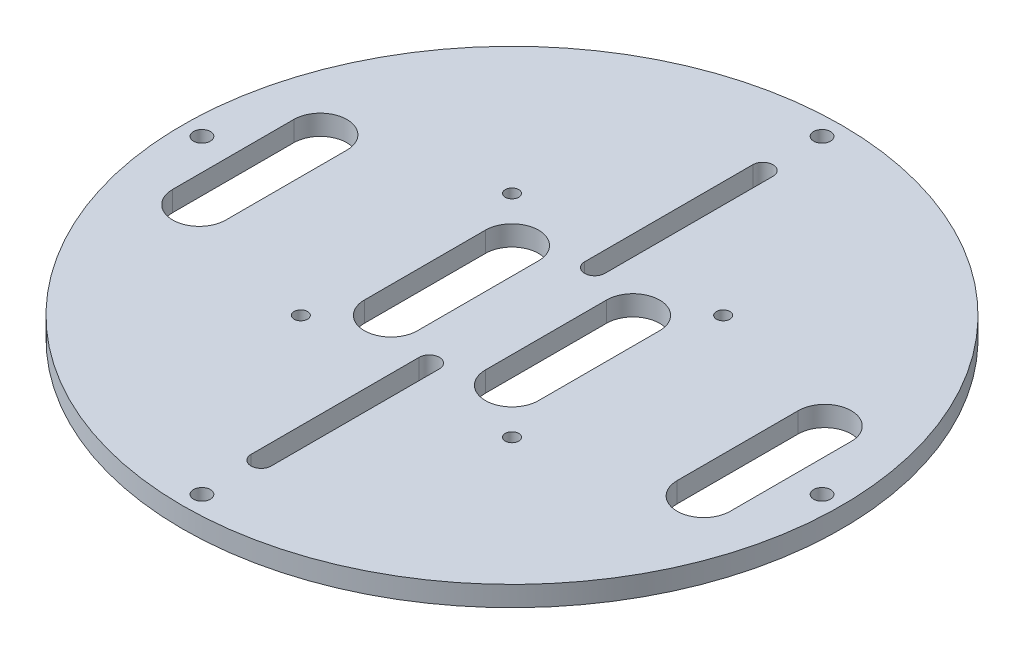
from build123d import *

# Parameters (mm, degrees)
SKETCH_1_R                      = 49
EXTRUDE_1_DEPTH                 = 3
CUT_EXTRUDE_1_DEPTH             = 70.361372535
PATTERN_CIRCULAR_2_COUNT        = 2
CUT_EXTRUDE_3_DEPTH             = 70.361372535
PATTERN_LINEAR_1_COUNT          = 2
PATTERN_LINEAR_1_PITCH          = 28.5
PATTERN_CIRCULAR_5_COUNT        = 2
PATTERN_CIRCULAR_5_COPY_1_DEPTH = 70.361372535
SKETCH_14_R                     = 1.25
CUT_EXTRUDE_4_DEPTH             = 70.361372535
PATTERN_CIRCULAR_6_COUNT        = 4
SKETCH_8_R                      = 1
CUT_EXTRUDE_5_DEPTH             = 70.361372535
PATTERN_CIRCULAR_7_COUNT        = 4


with BuildPart() as part:
    # 草图1 → 凸台-拉伸1 (new body)
    with BuildSketch(Plane(origin=(0, 0, 0), x_dir=(1, 0, 0), z_dir=(0, 1, 0))):
        Circle(SKETCH_1_R)
    extrude(amount=EXTRUDE_1_DEPTH)

    # 草图6 → 切除-拉伸1 (cut, through all)
    with BuildSketch(Plane(origin=(0, 3, 0), x_dir=(1, 0, 0), z_dir=(0, 1, 0))):
        with BuildLine():
            Line((-1.5, 12.3), (-1.5, 37.3))
            ThreePointArc((-1.5, 37.3), (0, 38.8), (1.5, 37.3))
            Line((1.5, 37.3), (1.5, 12.3))
            ThreePointArc((1.5, 12.3), (0, 10.8), (-1.5, 12.3))
        make_face()
    cut_extrude_1 = extrude(amount=-CUT_EXTRUDE_1_DEPTH, mode=Mode.SUBTRACT)

    # 阵列(圆周)2: 切除-拉伸1 ×2 about axis
    pattern_circular_2_axis = Axis((0, 3, 0), (0, -1, 0))
    for i in range(1, PATTERN_CIRCULAR_2_COUNT):
        add(cut_extrude_1.rotate(pattern_circular_2_axis, i * 360 / PATTERN_CIRCULAR_2_COUNT), mode=Mode.SUBTRACT)

    # 草图9 → 切除-拉伸3 (cut, through all)
    with BuildSketch(Plane(origin=(0, 3, 0), x_dir=(1, 0, 0), z_dir=(0, 1, 0))):
        with BuildLine():
            Line((-12.95, -9), (-12.95, 9))
            ThreePointArc((-12.95, 9), (-9, 12.95), (-5.05, 9))
            Line((-5.05, 9), (-5.05, -9))
            ThreePointArc((-5.05, -9), (-9, -12.95), (-12.95, -9))
        make_face()
    cut_extrude_3 = extrude(amount=-CUT_EXTRUDE_3_DEPTH, mode=Mode.SUBTRACT)

    # 阵列(线性)1: 切除-拉伸3 ×2
    with Locations(*[(-i * PATTERN_LINEAR_1_PITCH, 0, 0) for i in range(1, PATTERN_LINEAR_1_COUNT)]):
        add(cut_extrude_3, mode=Mode.SUBTRACT)

    # 阵列(圆周)5: 切除-拉伸3 ×2 about axis
    pattern_circular_5_axis = Axis((0, 3, 0), (0, -1, 0))
    for i in range(1, PATTERN_CIRCULAR_5_COUNT):
        add(cut_extrude_3.rotate(pattern_circular_5_axis, i * 360 / PATTERN_CIRCULAR_5_COUNT), mode=Mode.SUBTRACT)

    # 阵列(圆周)5 copy 1 sketch → 阵列(圆周)5 copy 1 (cut, through all)
    with BuildSketch(Plane(origin=(28.5, 3, 0), x_dir=(-1, 0, 0), z_dir=(0, 1, 0))):
        with BuildLine():
            Line((-12.95, -9), (-12.95, 9))
            ThreePointArc((-12.95, 9), (-9, 12.95), (-5.05, 9))
            Line((-5.05, 9), (-5.05, -9))
            ThreePointArc((-5.05, -9), (-9, -12.95), (-12.95, -9))
        make_face()
    extrude(amount=-PATTERN_CIRCULAR_5_COPY_1_DEPTH, mode=Mode.SUBTRACT)

    # 草图14 → 切除-拉伸4 (cut, through all)
    with BuildSketch(Plane(origin=(0, 3, 0), x_dir=(1, 0, 0), z_dir=(0, 1, 0))):
        with Locations((0, 46.1)):
            Circle(SKETCH_14_R)
    cut_extrude_4 = extrude(amount=-CUT_EXTRUDE_4_DEPTH, mode=Mode.SUBTRACT)

    # 阵列(圆周)6: 切除-拉伸4 ×4 about axis
    pattern_circular_6_axis = Axis((0, 3, 0), (0, -1, 0))
    for i in range(1, PATTERN_CIRCULAR_6_COUNT):
        add(cut_extrude_4.rotate(pattern_circular_6_axis, i * 360 / PATTERN_CIRCULAR_6_COUNT), mode=Mode.SUBTRACT)

    # 草图8 → 切除-拉伸5 (cut, through all)
    with BuildSketch(Plane(origin=(0, 3, 0), x_dir=(1, 0, 0), z_dir=(0, 1, 0))):
        with Locations((-15.7, 15.7)):
            Circle(SKETCH_8_R)
    cut_extrude_5 = extrude(amount=-CUT_EXTRUDE_5_DEPTH, mode=Mode.SUBTRACT)

    # 阵列(圆周)7: 切除-拉伸5 ×4 about axis
    pattern_circular_7_axis = Axis((0, 3, 0), (0, -1, 0))
    for i in range(1, PATTERN_CIRCULAR_7_COUNT):
        add(cut_extrude_5.rotate(pattern_circular_7_axis, i * 360 / PATTERN_CIRCULAR_7_COUNT), mode=Mode.SUBTRACT)


solid = part.part
